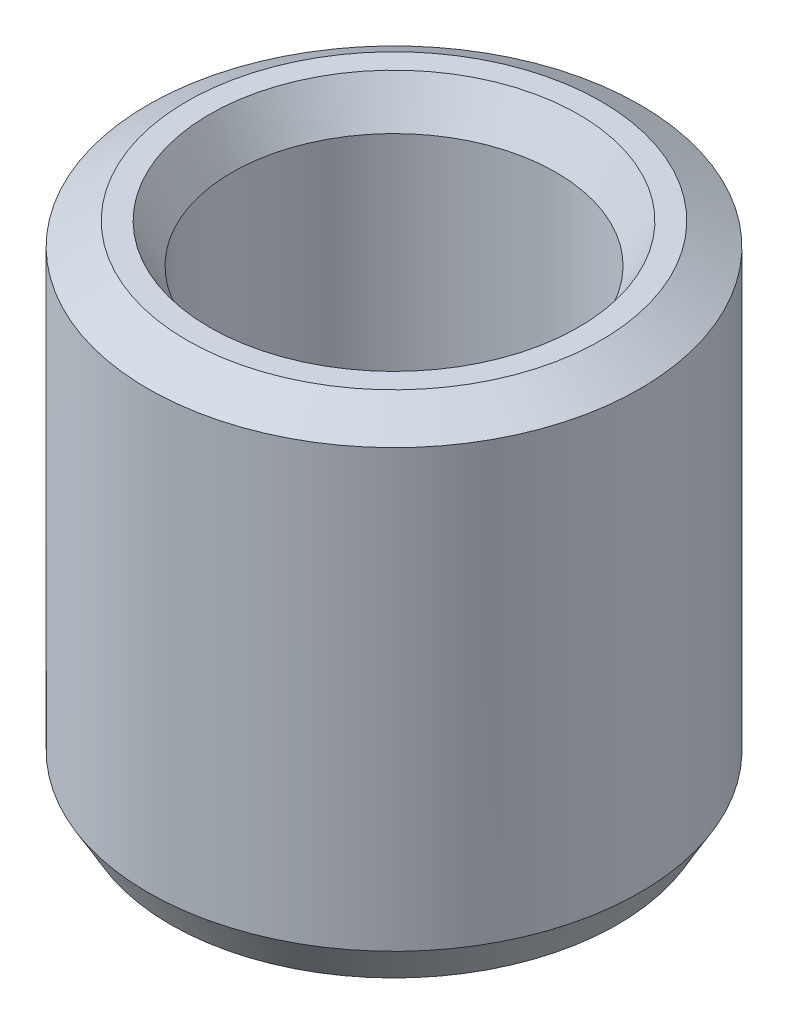
from build123d import *
from OCP.BRepFilletAPI import BRepFilletAPI_MakeChamfer

# Parameters (mm, degrees)
SKETCH1_R           = 10
BOSS_EXTRUDE1_DEPTH = 20.231477031
SKETCH2_R           = 6.584097801
CUT_EXTRUDE1_DEPTH  = 25.684259415
CHAMFER1_SIZE       = 0.915102028
CHAMFER1_SIZE2      = 1.585003207


with BuildPart() as part:
    # Sketch1 → Boss-Extrude1 (new body)
    with BuildSketch(Plane(origin=(0, 0, 0), x_dir=(1, 0, 0), z_dir=(0, 1, 0))):
        Circle(SKETCH1_R)
    extrude(amount=BOSS_EXTRUDE1_DEPTH)

    # Sketch2 → Cut-Extrude1 (cut, through all)
    with BuildSketch(Plane(origin=(0, 0, 0), x_dir=(1, 0, 0), z_dir=(0, 1, 0))):
        Circle(SKETCH2_R)
    extrude(amount=CUT_EXTRUDE1_DEPTH, mode=Mode.SUBTRACT)

    # Chamfer1: one chamfer whose edges measure the first distance from different faces: ONE call of the kernel's chamfer builder (chamfer() names one face for all edges)
    chamfer1_edges_1 = [part.edges().sort_by_distance(p)[0] for p in [
        (-6.584097801, 20.231477031, 0),
    ]]
    chamfer1_side_1 = [part.faces().sort_by_distance(p)[0] for p in [
        (-9.717157288, 20.231477031, 0),
    ]]
    chamfer1_edges_2 = [part.edges().sort_by_distance(p)[0] for p in [
        (-6.584097801, 0, 0),
    ]]
    chamfer1_side_2 = [part.faces().sort_by_distance(p)[0] for p in [
        (-6.584097801, 10.115738516, 0),
    ]]
    chamfer1_edges_3 = [part.edges().sort_by_distance(p)[0] for p in [
        (-10, 0, 0),
    ]]
    chamfer1_side_3 = [part.faces().sort_by_distance(p)[0] for p in [
        (-9.717157288, 0, 0),
    ]]
    chamfer1_edges_4 = [part.edges().sort_by_distance(p)[0] for p in [
        (-10, 20.231477031, 0),
    ]]
    chamfer1_side_4 = [part.faces().sort_by_distance(p)[0] for p in [
        (-10, 10.115738516, 0),
    ]]
    chamfer1 = BRepFilletAPI_MakeChamfer(part.part.solid().wrapped)
    for e in chamfer1_edges_1:
        chamfer1.Add(CHAMFER1_SIZE, CHAMFER1_SIZE2, e.wrapped, chamfer1_side_1[0].wrapped)  # the first distance lies on this face
    for e in chamfer1_edges_2:
        chamfer1.Add(CHAMFER1_SIZE, CHAMFER1_SIZE2, e.wrapped, chamfer1_side_2[0].wrapped)  # the first distance lies on this face
    for e in chamfer1_edges_3:
        chamfer1.Add(CHAMFER1_SIZE, CHAMFER1_SIZE2, e.wrapped, chamfer1_side_3[0].wrapped)  # the first distance lies on this face
    for e in chamfer1_edges_4:
        chamfer1.Add(CHAMFER1_SIZE, CHAMFER1_SIZE2, e.wrapped, chamfer1_side_4[0].wrapped)  # the first distance lies on this face
    add(Compound.cast(chamfer1.Shape()), mode=Mode.REPLACE)


solid = part.part
